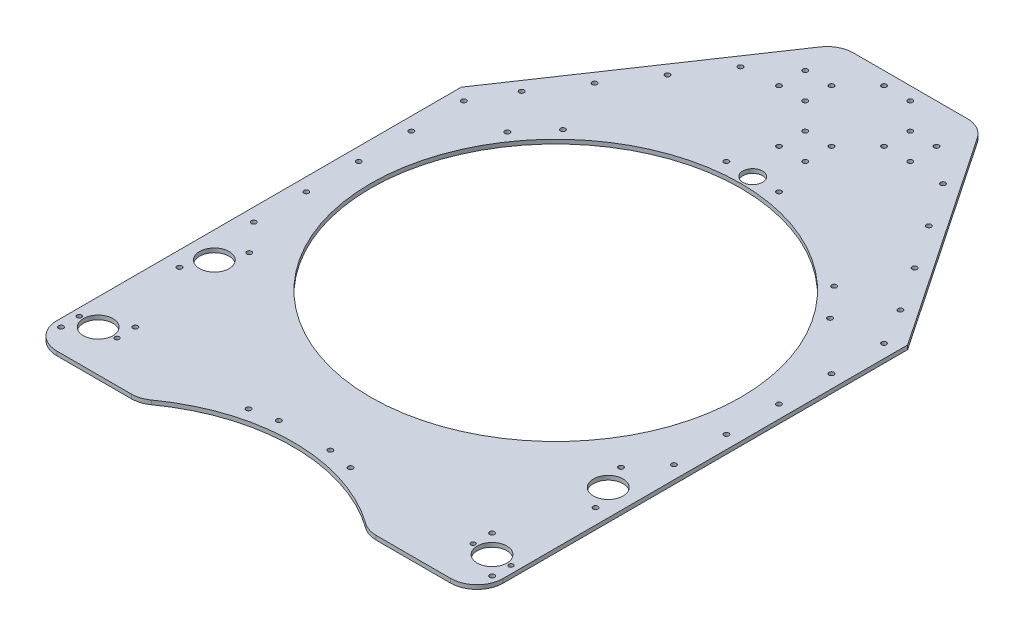
from build123d import *

# Parameters (mm, degrees)
SKETCH1_W           = 431.8
SKETCH1_H           = 685.8
BOSS_EXTRUDE1_DEPTH = 4
SKETCH2_R           = 14.3129
SKETCH2_R_2         = 2.38125
SKETCH2_R_3         = 2.159
CUT_EXTRUDE1_DEPTH  = 406.227368276
SKETCH6_R           = 179.07
CUT_EXTRUDE4_DEPTH  = 406.227368276
SKETCH8_R           = 9.525
SKETCH8_R_2         = 2.38125
CUT_EXTRUDE6_DEPTH  = 406.227368276
FILLET2_R           = 25.4
SKETCH11_R          = 2.38125
CUT_EXTRUDE9_DEPTH  = 406.227368276
SKETCH13_R          = 2.38125
SKETCH13_R_2        = 2.466421692
SKETCH13_R_3        = 2.307769972
CUT_EXTRUDE10_DEPTH = 406.227368276
SKETCH16_W          = 431.8
SKETCH16_H          = 50.8
CUT_EXTRUDE13_DEPTH = 406.227368276
SKETCH17_R          = 177.8
SKETCH17_R_2        = 2.38125
CUT_EXTRUDE14_DEPTH = 406.227368276
FILLET3_R           = 25.4
SKETCH18_R          = 2.38125
CUT_EXTRUDE15_DEPTH = 406.227368276
CHAMFER1_SIZE       = 147.32
CHAMFER1_SIZE2      = 218.410881881
CHAMFER2_SIZE       = 147.32
CHAMFER2_SIZE2      = 218.410881881
FILLET4_R           = 25.4
SKETCH19_R          = 2.38125
CUT_EXTRUDE16_DEPTH = 406.227368276


with BuildPart() as part:
    # Sketch1 → Boss-Extrude1 (new body)
    with BuildSketch(Plane(origin=(0, 0, 0), x_dir=(1, 0, 0), z_dir=(0, 1, 0))):
        Rectangle(SKETCH1_W, SKETCH1_H)
    extrude(amount=BOSS_EXTRUDE1_DEPTH)

    # Sketch2 → Cut-Extrude1 (cut, through all)
    with BuildSketch(Plane(origin=(0, 4, 0), x_dir=(1, 0, 0), z_dir=(0, 1, 0))):
        with Locations((-190.5, -302.895)):
            Circle(SKETCH2_R)
        with Locations((-190.5, -190.5)):
            Circle(SKETCH2_R)
        with Locations((190.5, -190.5)):
            Circle(SKETCH2_R)
        with Locations((201.234503848, -213.520217791)):
            Circle(SKETCH2_R_2)
        with Locations((179.765496152, -167.479782209)):
            Circle(SKETCH2_R_2)
        with Locations((-208.460512242, -320.855512242)):
            Circle(SKETCH2_R_2)
        with Locations((-172.539487758, -284.934487758)):
            Circle(SKETCH2_R_2)
        with Locations((172.539487758, -284.934487758)):
            Circle(SKETCH2_R_2)
        with Locations((208.460512242, -320.855512242)):
            Circle(SKETCH2_R_2)
        with Locations((190.5, -302.895)):
            Circle(SKETCH2_R)
        with Locations((-179.765496152, -167.479782209)):
            Circle(SKETCH2_R_2)
        with Locations((-201.234503848, -213.520217791)):
            Circle(SKETCH2_R_2)
        with Locations((208.788, -302.895)):
            Circle(SKETCH2_R_3)
        with Locations((172.212, -302.895)):
            Circle(SKETCH2_R_3)
        with Locations((-172.212, -302.895)):
            Circle(SKETCH2_R_3)
        with Locations((-208.788, -302.895)):
            Circle(SKETCH2_R_3)
    extrude(amount=-CUT_EXTRUDE1_DEPTH, mode=Mode.SUBTRACT)

    # Sketch6 → Cut-Extrude4 (cut, through all)
    with BuildSketch(Plane(origin=(0, 4, 0), x_dir=(1, 0, 0), z_dir=(0, 1, 0))):
        with Locations((0, -50.8)):
            Circle(SKETCH6_R)
    extrude(amount=-CUT_EXTRUDE4_DEPTH, mode=Mode.SUBTRACT)

    # Sketch8 → Cut-Extrude6 (cut, through all)
    with BuildSketch(Plane(origin=(0, 4, 0), x_dir=(1, 0, 0), z_dir=(0, 1, 0))):
        with Locations((0, 139.7)):
            Circle(SKETCH8_R)
        with Locations((25.4, 139.7)):
            Circle(SKETCH8_R_2)
        with Locations((-25.4, 139.7)):
            Circle(SKETCH8_R_2)
    extrude(amount=-CUT_EXTRUDE6_DEPTH, mode=Mode.SUBTRACT)

    # Fillet2
    fillet2_edges = [part.edges().sort_by_distance(p)[0] for p in [
        (215.9, 2, 342.9),
        (-215.9, 2, 342.9),
    ]]
    fillet(fillet2_edges, radius=FILLET2_R)

    # Sketch11 → Cut-Extrude9 (cut, through all)
    with BuildSketch(Plane(origin=(0, 4, 0), x_dir=(1, 0, 0), z_dir=(0, 1, 0))):
        with Locations((156.048464437, 58.466311125)):
            Circle(SKETCH11_R)
        with Locations((131.183773775, 87.334237241)):
            Circle(SKETCH11_R)
        with Locations((-131.183773775, 87.334237241)):
            Circle(SKETCH11_R)
        with Locations((-156.048464437, 58.466311125)):
            Circle(SKETCH11_R)
    extrude(amount=-CUT_EXTRUDE9_DEPTH, mode=Mode.SUBTRACT)

    # Sketch13 → Cut-Extrude10 (cut, through all)
    with BuildSketch(Plane(origin=(0, 4, 0), x_dir=(1, 0, 0), z_dir=(0, 1, 0))):
        with Locations((-203.2, 317.5)):
            Circle(SKETCH13_R)
        with Locations((-203.2, 266.7)):
            Circle(SKETCH13_R)
        with Locations((-203.2, 215.9)):
            Circle(SKETCH13_R)
        with Locations((-203.2, 165.1)):
            Circle(SKETCH13_R)
        with Locations((-203.2, 114.3)):
            Circle(SKETCH13_R)
        with Locations((-203.2, 63.5)):
            Circle(SKETCH13_R)
        with Locations((-203.2, 12.7)):
            Circle(SKETCH13_R)
        with Locations((-203.2, -38.1)):
            Circle(SKETCH13_R)
        with Locations((-203.2, -88.9)):
            Circle(SKETCH13_R)
        with Locations((-203.2, -139.7)):
            Circle(SKETCH13_R)
        with Locations((203.2, -139.7)):
            Circle(SKETCH13_R)
        with Locations((203.2, 12.7)):
            Circle(SKETCH13_R)
        with Locations((203.2, 63.5)):
            Circle(SKETCH13_R)
        with Locations((203.2, 114.3)):
            Circle(SKETCH13_R)
        with Locations((203.2, 165.1)):
            Circle(SKETCH13_R)
        with Locations((203.2, 266.7)):
            Circle(SKETCH13_R)
        with Locations((203.2, 317.5)):
            Circle(SKETCH13_R)
        with Locations((-25.4, -330.2)):
            Circle(SKETCH13_R_2)
        with Locations((-50.8, -330.2)):
            Circle(SKETCH13_R_3)
        with Locations((50.8, -330.2)):
            Circle(SKETCH13_R_3)
        with Locations((25.4, -330.2)):
            Circle(SKETCH13_R_2)
        with Locations((203.2, -88.9)):
            Circle(SKETCH13_R)
        with Locations((203.2, -38.1)):
            Circle(SKETCH13_R)
        with Locations((203.2, 215.9)):
            Circle(SKETCH13_R)
    extrude(amount=-CUT_EXTRUDE10_DEPTH, mode=Mode.SUBTRACT)

    # Sketch16 → Cut-Extrude13 (cut, through all)
    with BuildSketch(Plane(origin=(0, 4, 0), x_dir=(1, 0, 0), z_dir=(0, 1, 0))):
        with Locations((0, 317.5)):
            Rectangle(SKETCH16_W, SKETCH16_H)
    extrude(amount=-CUT_EXTRUDE13_DEPTH, mode=Mode.SUBTRACT)

    # Sketch17 → Cut-Extrude14 (cut, through all)
    with BuildSketch(Plane(origin=(0, 0, 0), x_dir=(-1, 0, 0), z_dir=(0, -1, 0))):
        with Locations((0, -482.6)):
            Circle(SKETCH17_R)
        with Locations((24.865239618, -293.729753908)):
            Circle(SKETCH17_R_2)
        with Locations((49.305028092, -298.591130092)):
            Circle(SKETCH17_R_2)
        with Locations((-24.865239618, -293.729753908)):
            Circle(SKETCH17_R_2)
        with Locations((-49.305028092, -298.591130092)):
            Circle(SKETCH17_R_2)
    extrude(amount=-CUT_EXTRUDE14_DEPTH, mode=Mode.SUBTRACT)

    # Fillet3
    fillet3_edges = [part.edges().sort_by_distance(p)[0] for p in [
        (109.985226281, 2, 342.9),
        (-109.985226281, 2, 342.9),
    ]]
    fillet(fillet3_edges, radius=FILLET3_R)

    # Sketch18 → Cut-Extrude15 (cut, through all)
    with BuildSketch(Plane(origin=(0, 4, 0), x_dir=(1, 0, 0), z_dir=(0, 1, 0))):
        with Locations((38.1, 228.6)):
            Circle(SKETCH18_R)
        with Locations((63.5, 228.6)):
            Circle(SKETCH18_R)
        with Locations((63.5, 254)):
            Circle(SKETCH18_R)
        with Locations((38.1, 254)):
            Circle(SKETCH18_R)
        with Locations((-12.7, 177.8)):
            Circle(SKETCH18_R)
        with Locations((-12.7, 203.2)):
            Circle(SKETCH18_R)
        with Locations((12.7, 177.8)):
            Circle(SKETCH18_R)
        with Locations((12.7, 203.2)):
            Circle(SKETCH18_R)
        with Locations((-63.5, 254)):
            Circle(SKETCH18_R)
        with Locations((-38.1, 254)):
            Circle(SKETCH18_R)
        with Locations((-63.5, 228.6)):
            Circle(SKETCH18_R)
        with Locations((-38.1, 228.6)):
            Circle(SKETCH18_R)
        with Locations((12.7, 304.8)):
            Circle(SKETCH18_R)
        with Locations((12.7, 279.4)):
            Circle(SKETCH18_R)
        with Locations((-12.7, 304.8)):
            Circle(SKETCH18_R)
        with Locations((-12.7, 279.4)):
            Circle(SKETCH18_R)
    extrude(amount=-CUT_EXTRUDE15_DEPTH, mode=Mode.SUBTRACT)

    # Chamfer1
    chamfer1_edges = [part.edges().sort_by_distance(p)[0] for p in [
        (215.9, 2, -292.1),
    ]]
    chamfer1_side = [part.faces().sort_by_distance(p)[0] for p in [
        (0, 2, -292.1),
    ]]
    chamfer(chamfer1_edges, length=CHAMFER1_SIZE, length2=CHAMFER1_SIZE2, reference=chamfer1_side[0])

    # Chamfer2
    chamfer2_edges = [part.edges().sort_by_distance(p)[0] for p in [
        (-215.9, 2, -292.1),
    ]]
    chamfer2_side = [part.faces().sort_by_distance(p)[0] for p in [
        (-73.66, 2, -292.1),
    ]]
    chamfer(chamfer2_edges, length=CHAMFER2_SIZE, length2=CHAMFER2_SIZE2, reference=chamfer2_side[0])

    # Fillet4
    fillet4_edges = [part.edges().sort_by_distance(p)[0] for p in [
        (68.58, 2, -292.1),
        (-68.58, 2, -292.1),
    ]]
    fillet(fillet4_edges, radius=FILLET4_R)

    # Sketch19 → Cut-Extrude16 (cut, through all)
    with BuildSketch(Plane(origin=(0, 4, 0), x_dir=(1, 0, 0), z_dir=(0, 1, 0))):
        with Locations((-97.97689967, 225.806)):
            Circle(SKETCH19_R)
        with Locations((-126.383899166, 183.690891314)):
            Circle(SKETCH19_R)
        with Locations((-154.790898662, 141.575782628)):
            Circle(SKETCH19_R)
        with Locations((-183.197898158, 99.460673943)):
            Circle(SKETCH19_R)
        with Locations((183.197898158, 99.460673943)):
            Circle(SKETCH19_R)
        with Locations((154.790898662, 141.575782628)):
            Circle(SKETCH19_R)
        with Locations((126.383899166, 183.690891314)):
            Circle(SKETCH19_R)
        with Locations((97.97689967, 225.806)):
            Circle(SKETCH19_R)
    extrude(amount=-CUT_EXTRUDE16_DEPTH, mode=Mode.SUBTRACT)


solid = part.part
